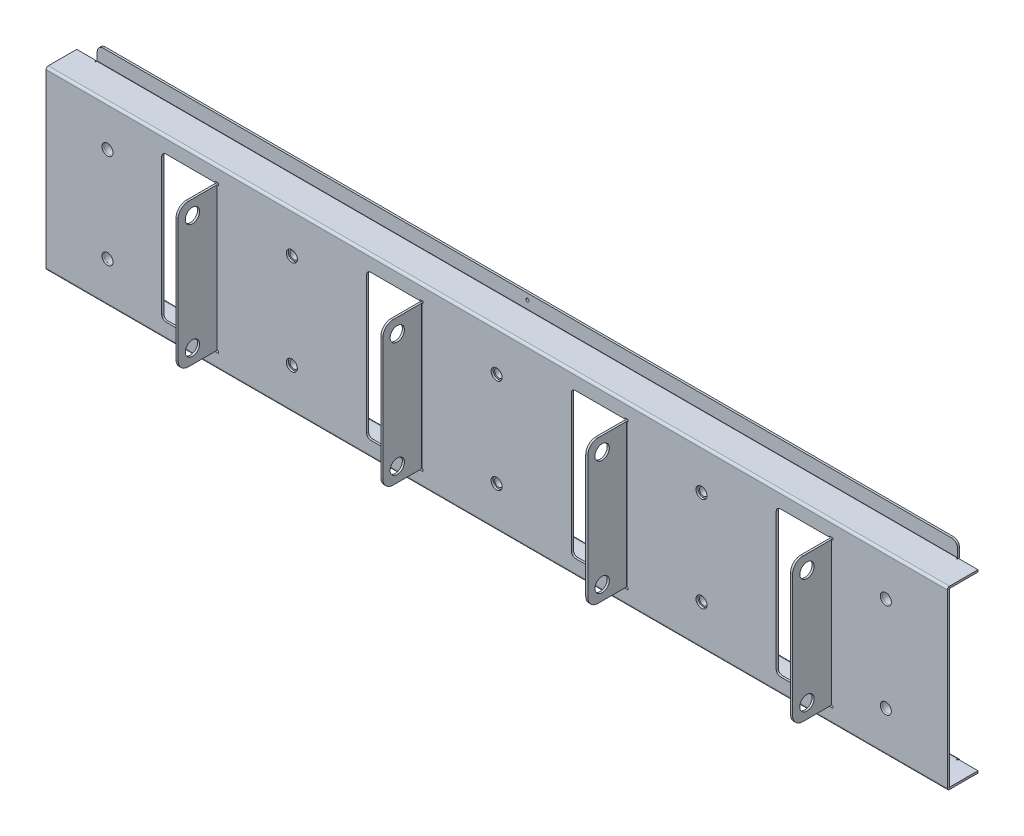
from build123d import *

# Parameters (mm, degrees)
SKETCH_1_W                          = 440
SKETCH_1_H                          = 86
SM_BASE_FLANGE_1_DEPTH              = 1
SM_EDGE_FLANGE_1_STRIP_W            = 4.2
SM_EDGE_FLANGE_1_STRIP_H            = 1
SM_EDGE_FLANGE_1_STRIP_CUT_DEPTH    = 440
SM_EDGE_FLANGE_1_STRIP_2_W          = 4.2
SM_EDGE_FLANGE_1_STRIP_2_H          = 1
SM_EDGE_FLANGE_1_STRIP_CUT_2_DEPTH  = 440
SM_EDGE_FLANGE_1_DEPTH              = 440
SM_EDGE_FLANGE_1_BEND_DEPTH         = 440
SM_EDGE_FLANGE_2_STRIP_W            = 5.2
SM_EDGE_FLANGE_2_STRIP_H            = 1
SM_EDGE_FLANGE_2_STRIP_CUT_DEPTH    = 420
SM_EDGE_FLANGE_2_RELIEF_W           = 5.7
SM_EDGE_FLANGE_2_RELIEF_H           = 0.5
SM_EDGE_FLANGE_2_RELIEF_CUT_DEPTH   = 1
SM_EDGE_FLANGE_2_STRIP_2_W          = 5.2
SM_EDGE_FLANGE_2_STRIP_2_H          = 1
SM_EDGE_FLANGE_2_STRIP_CUT_2_DEPTH  = 420
SM_EDGE_FLANGE_2_RELIEF_2_W         = 5.7
SM_EDGE_FLANGE_2_RELIEF_2_H         = 0.5
SM_EDGE_FLANGE_2_RELIEF_CUT_2_DEPTH = 1
SM_EDGE_FLANGE_2_DEPTH              = 420
SM_EDGE_FLANGE_2_BEND_DEPTH         = 420
SKETCH_18_W                         = 26
SKETCH_18_H                         = 71
CUT_EXTRUDE_1_DEPTH                 = 10
SM_START                            = -36
SM_EDGE_FLANGE_3_DEPTH              = 72
SM_EDGE_FLANGE_3_2_DEPTH            = 0.5
SM_START_2                          = 35.5
SM_EDGE_FLANGE_3_3_DEPTH            = 0.5
SM_START_3                          = -35.5
SM_EDGE_FLANGE_3_4_DEPTH            = 71
SKETCH_22_R                         = 3.5
CUT_EXTRUDE_2_DEPTH                 = 10
FILLET_1_R                          = 5
PATTERN_LINEAR_4_COUNT              = 2
PATTERN_LINEAR_4_PITCH              = 100
FILLET_1_OF_PATTERN_LINEAR_4_R      = 5
PATTERN_LINEAR_5_COUNT              = 3
PATTERN_LINEAR_5_PITCH              = 100
FILLET_1_OF_PATTERN_LINEAR_5_R      = 5
FILLET_2_R                          = 3
FILLET_3_R                          = 2
SKETCH_23_R                         = 2.7
CUT_EXTRUDE_3_DEPTH                 = 10
SKETCH_24_R                         = 4
SKETCH_24_R_2                       = 2
EXTRUDE_1_DEPTH                     = 3
EXTRUDE_1_2_DEPTH                   = 3
EXTRUDE_1_3_DEPTH                   = 3
EXTRUDE_1_4_DEPTH                   = 3
EXTRUDE_1_5_DEPTH                   = 3
EXTRUDE_1_6_DEPTH                   = 3
SKETCH_24_R_3                       = 2.7
EXTRUDE_1_7_DEPTH                   = 3
EXTRUDE_1_8_DEPTH                   = 3
EXTRUDE_1_9_DEPTH                   = 3
EXTRUDE_1_10_DEPTH                  = 3
CUT_EXTRUDE_5_DEPTH                 = 227.408922086
CUT_EXTRUDE_5_DEPTH_BACK            = 227.408922086
SKETCH_25_R                         = 0.75
MOVE_START                          = -137.5
MOVE_FACE_1_DEPTH                   = 301.1
MOVE_FACE_1_2_OUTLINE_W             = 0.5
MOVE_FACE_1_2_OUTLINE_H             = 1
MOVE_FACE_1_2_DEPTH                 = 1.6
MOVE_START_2                        = -37.5
MOVE_FACE_1_3_OUTLINE_W             = 0.5
MOVE_FACE_1_3_OUTLINE_H             = 1
MOVE_FACE_1_3_DEPTH                 = 1.6
MOVE_START_3                        = 62.5
MOVE_FACE_1_4_OUTLINE_W             = 0.5
MOVE_FACE_1_4_OUTLINE_H             = 1
MOVE_FACE_1_4_DEPTH                 = 1.6
MOVE_START_4                        = 162.5
MOVE_FACE_1_5_OUTLINE_W             = 0.5
MOVE_FACE_1_5_OUTLINE_H             = 1
MOVE_FACE_1_5_DEPTH                 = 1.6
MOVE_FACE_2_DEPTH                   = 301.1
MOVE_FACE_2_2_OUTLINE_W             = 0.5
MOVE_FACE_2_2_OUTLINE_H             = 1
MOVE_FACE_2_2_DEPTH                 = 1.6
MOVE_FACE_2_3_OUTLINE_W             = 0.5
MOVE_FACE_2_3_OUTLINE_H             = 1
MOVE_FACE_2_3_DEPTH                 = 1.6
MOVE_FACE_2_4_OUTLINE_W             = 0.5
MOVE_FACE_2_4_OUTLINE_H             = 1
MOVE_FACE_2_4_DEPTH                 = 1.6
MOVE_FACE_2_5_OUTLINE_W             = 0.5
MOVE_FACE_2_5_OUTLINE_H             = 1
MOVE_FACE_2_5_DEPTH                 = 1.6


# Read off the part's stored shape, not the designer's step: 边线-法兰3, 移动面1, 移动面2
# Sheet-metal steps are written as plain solids
with BuildPart() as part:
    # Sketch 1 → 基体-法兰1 (new body)
    with BuildSketch(Plane.XY):
        Rectangle(SKETCH_1_W, SKETCH_1_H)
    extrude(amount=-SM_BASE_FLANGE_1_DEPTH)

    # 边线-法兰1 strip (across the edge) → 边线-法兰1 strip cut (cut)
    with BuildSketch(Plane(origin=(-220, 43, -1), x_dir=(0, -1, 0), z_dir=(1, 0, 0))):
        with Locations((-1, -0.5)):
            Rectangle(SM_EDGE_FLANGE_1_STRIP_W, SM_EDGE_FLANGE_1_STRIP_H)
    extrude(amount=SM_EDGE_FLANGE_1_STRIP_CUT_DEPTH, mode=Mode.SUBTRACT)

    # 边线-法兰1 strip 2 (across the edge) → 边线-法兰1 strip cut 2 (cut)
    with BuildSketch(Plane(origin=(220, -43, -1), x_dir=(0, 1, 0), z_dir=(-1, 0, 0))):
        with Locations((-1, -0.5)):
            Rectangle(SM_EDGE_FLANGE_1_STRIP_2_W, SM_EDGE_FLANGE_1_STRIP_2_H)
    extrude(amount=SM_EDGE_FLANGE_1_STRIP_CUT_2_DEPTH, mode=Mode.SUBTRACT)

    # 边线-法兰1 section (across the edge) → 边线-法兰1 (add)
    with BuildSketch(Plane(origin=(-220, 43, -1), x_dir=(0, -1, 0), z_dir=(1, 0, 0))):
        with BuildLine():
            Line((0, 0.1), (0, 14))
            Line((0, 14), (1, 14))
            Line((1, 14), (1, 0.1))
            ThreePointArc((1, 0.1), (1.029289322, 0.029289322), (1.1, 0))
            Line((1.1, 0), (1.1, -1))
            ThreePointArc((1.1, -1), (0.322182541, -0.677817459), (0, 0.1))
        make_face()
    extrude(amount=SM_EDGE_FLANGE_1_DEPTH)

    # 边线-法兰1 section 2 (across the edge) → 边线-法兰1 bend (add)
    with BuildSketch(Plane(origin=(220, -43, -1), x_dir=(0, 1, 0), z_dir=(-1, 0, 0))):
        with BuildLine():
            Line((0, 0.1), (0, 14))
            Line((0, 14), (1, 14))
            Line((1, 14), (1, 0.1))
            ThreePointArc((1, 0.1), (1.029289322, 0.029289322), (1.1, 0))
            Line((1.1, 0), (1.1, -1))
            ThreePointArc((1.1, -1), (0.322182541, -0.677817459), (0, 0.1))
        make_face()
    extrude(amount=SM_EDGE_FLANGE_1_BEND_DEPTH)

    # 边线-法兰2 strip (across the edge) → 边线-法兰2 strip cut (cut)
    with BuildSketch(Plane(origin=(210, 43, -16), x_dir=(0, 0, 1), z_dir=(-1, 0, 0))):
        with Locations((-1.5, -0.5)):
            Rectangle(SM_EDGE_FLANGE_2_STRIP_W, SM_EDGE_FLANGE_2_STRIP_H)
    extrude(amount=SM_EDGE_FLANGE_2_STRIP_CUT_DEPTH, mode=Mode.SUBTRACT)

    # 边线-法兰2 relief (on the sheet) → 边线-法兰2 relief cut (cut)
    with BuildSketch(Plane(origin=(210, 43, -14.9), x_dir=(0, 0, 1), z_dir=(0, 1, 0))):
        with Locations((-2.35, 0.25)):
            Rectangle(SM_EDGE_FLANGE_2_RELIEF_W, SM_EDGE_FLANGE_2_RELIEF_H)
        with Locations((-2.35, -420.25)):
            Rectangle(SM_EDGE_FLANGE_2_RELIEF_W, SM_EDGE_FLANGE_2_RELIEF_H)
    extrude(amount=-SM_EDGE_FLANGE_2_RELIEF_CUT_DEPTH, mode=Mode.SUBTRACT)

    # 边线-法兰2 strip 2 (across the edge) → 边线-法兰2 strip cut 2 (cut)
    with BuildSketch(Plane(origin=(-210, -43, -16), x_dir=(0, 0, 1), z_dir=(1, 0, 0))):
        with Locations((-1.5, -0.5)):
            Rectangle(SM_EDGE_FLANGE_2_STRIP_2_W, SM_EDGE_FLANGE_2_STRIP_2_H)
    extrude(amount=SM_EDGE_FLANGE_2_STRIP_CUT_2_DEPTH, mode=Mode.SUBTRACT)

    # 边线-法兰2 relief 2 (on the sheet) → 边线-法兰2 relief cut 2 (cut)
    with BuildSketch(Plane(origin=(-210, -43, -14.9), x_dir=(0, 0, 1), z_dir=(0, -1, 0))):
        with Locations((-2.35, 0.25)):
            Rectangle(SM_EDGE_FLANGE_2_RELIEF_2_W, SM_EDGE_FLANGE_2_RELIEF_2_H)
        with Locations((-2.35, -420.25)):
            Rectangle(SM_EDGE_FLANGE_2_RELIEF_2_W, SM_EDGE_FLANGE_2_RELIEF_2_H)
    extrude(amount=-SM_EDGE_FLANGE_2_RELIEF_CUT_2_DEPTH, mode=Mode.SUBTRACT)

    # 边线-法兰2 section (across the edge) → 边线-法兰2 (add)
    with BuildSketch(Plane(origin=(210, 43, -16), x_dir=(0, 0, 1), z_dir=(-1, 0, 0))):
        with BuildLine():
            Line((0, 0.1), (0, 7))
            Line((0, 7), (1, 7))
            Line((1, 7), (1, 0.1))
            ThreePointArc((1, 0.1), (1.029289322, 0.029289322), (1.1, 0))
            Line((1.1, 0), (1.1, -1))
            ThreePointArc((1.1, -1), (0.322182541, -0.677817459), (0, 0.1))
        make_face()
    extrude(amount=SM_EDGE_FLANGE_2_DEPTH)

    # 边线-法兰2 section 2 (across the edge) → 边线-法兰2 bend (add)
    with BuildSketch(Plane(origin=(-210, -43, -16), x_dir=(0, 0, 1), z_dir=(1, 0, 0))):
        with BuildLine():
            Line((0, 0.1), (0, 7))
            Line((0, 7), (1, 7))
            Line((1, 7), (1, 0.1))
            ThreePointArc((1, 0.1), (1.029289322, 0.029289322), (1.1, 0))
            Line((1.1, 0), (1.1, -1))
            ThreePointArc((1.1, -1), (0.322182541, -0.677817459), (0, 0.1))
        make_face()
    extrude(amount=SM_EDGE_FLANGE_2_BEND_DEPTH)

    # 草图18 → 切除-拉伸1 (cut)
    with BuildSketch(Plane.XY):
        with Locations((49.5, 0)):
            Rectangle(SKETCH_18_W, SKETCH_18_H)
    cut_extrude_1 = extrude(amount=-CUT_EXTRUDE_1_DEPTH, mode=Mode.SUBTRACT)

    # 边线-法兰3 outline → 边线-法兰3 (cut)
    with BuildSketch(Plane(origin=(0, 0, 0), x_dir=(1, 0, 0), z_dir=(0, 1, 0)).offset(SM_START)):
        with BuildLine():
            ThreePointArc((62.504554885, 0), (62.858380152, 0.71240384), (63.6, 1))
            Line((63.6, 1), (62.5, 1))
            Line((62.5, 1), (62.5, 0))
            Line((62.5, 0), (62.504554885, 0))
        make_face()
    sm_edge_flange_3 = extrude(amount=SM_EDGE_FLANGE_3_DEPTH, mode=Mode.SUBTRACT)

    # Sm Edge Flange 3 2 outline → Sm Edge Flange 3 2 (cut)
    with BuildSketch(Plane(origin=(0, 0, 0), x_dir=(1, 0, 0), z_dir=(0, 1, 0)).offset(SM_START)):
        with BuildLine():
            Line((64.1, 0), (64.1, 1))
            Line((64.1, 1), (63.6, 1))
            ThreePointArc((63.6, 1), (62.858380152, 0.71240384), (62.504554885, 0))
            Line((62.504554885, 0), (64.1, 0))
        make_face()
    sm_edge_flange_3_2 = extrude(amount=SM_EDGE_FLANGE_3_2_DEPTH, mode=Mode.SUBTRACT)

    # Sm Edge Flange 3 3 outline → Sm Edge Flange 3 3 (cut)
    with BuildSketch(Plane(origin=(0, 0, 0), x_dir=(1, 0, 0), z_dir=(0, 1, 0)).offset(SM_START_2)):
        with BuildLine():
            Line((64.1, 0), (64.1, 1))
            Line((64.1, 1), (63.6, 1))
            ThreePointArc((63.6, 1), (62.858380152, 0.71240384), (62.504554885, 0))
            Line((62.504554885, 0), (64.1, 0))
        make_face()
    sm_edge_flange_3_3 = extrude(amount=SM_EDGE_FLANGE_3_3_DEPTH, mode=Mode.SUBTRACT)

    # Sm Edge Flange 3 4 outline → Sm Edge Flange 3 4 (add)
    with BuildSketch(Plane(origin=(0, 0, 0), x_dir=(1, 0, 0), z_dir=(0, 1, 0)).offset(SM_START_3)):
        with BuildLine():
            ThreePointArc((63.5, -0.1), (63.529289322, -0.029289322), (63.6, 0))
            Line((63.6, 0), (62.504554885, 0))
            ThreePointArc((62.504554885, 0), (62.501139311, -0.049948159), (62.5, -0.1))
            Line((62.5, -0.1), (62.5, -19))
            Line((62.5, -19), (63.5, -19))
            Line((63.5, -19), (63.5, -0.1))
        make_face()
    sm_edge_flange_3_4 = extrude(amount=SM_EDGE_FLANGE_3_4_DEPTH)

    # 草图22 → 切除-拉伸2 (cut)
    with BuildSketch(Plane.ZY.offset(-62.5)):
        with Locations((12, 28)):
            Circle(SKETCH_22_R)
        with Locations((12, -28)):
            Circle(SKETCH_22_R)
    cut_extrude_2 = extrude(amount=-CUT_EXTRUDE_2_DEPTH, mode=Mode.SUBTRACT)

    # 圆角1
    fillet_1_edges = [part.edges().sort_by_distance(p)[0] for p in [
        (63, 35.5, 19),
        (63, -35.5, 19),
    ]]
    fillet(fillet_1_edges, radius=FILLET_1_R)

    # 阵列(线性)4: 切除-拉伸1, 边线-法兰3, Sm Edge Flange 3 2, Sm Edge Flange 3 3, Sm Edge Flange 3 4, 切除-拉伸2 ×2
    with Locations(*[(i * PATTERN_LINEAR_4_PITCH, 0, 0) for i in range(1, PATTERN_LINEAR_4_COUNT)]):
        add(cut_extrude_1, mode=Mode.SUBTRACT)
        add(sm_edge_flange_3, mode=Mode.SUBTRACT)
        add(sm_edge_flange_3_2, mode=Mode.SUBTRACT)
        add(sm_edge_flange_3_3, mode=Mode.SUBTRACT)
        add(sm_edge_flange_3_4)
        add(cut_extrude_2, mode=Mode.SUBTRACT)

    # 圆角1 of 阵列(线性)4
    fillet_1_of_pattern_linear_4_edges = [part.edges().sort_by_distance(p)[0] for p in [
        (163, 35.5, 19),
        (163, -35.5, 19),
    ]]
    fillet(fillet_1_of_pattern_linear_4_edges, radius=FILLET_1_OF_PATTERN_LINEAR_4_R)

    # 阵列(线性)5: 切除-拉伸1, 边线-法兰3, Sm Edge Flange 3 2, Sm Edge Flange 3 3, Sm Edge Flange 3 4, 切除-拉伸2 ×3
    with Locations(*[(-i * PATTERN_LINEAR_5_PITCH, 0, 0) for i in range(1, PATTERN_LINEAR_5_COUNT)]):
        add(cut_extrude_1, mode=Mode.SUBTRACT)
        add(sm_edge_flange_3, mode=Mode.SUBTRACT)
        add(sm_edge_flange_3_2, mode=Mode.SUBTRACT)
        add(sm_edge_flange_3_3, mode=Mode.SUBTRACT)
        add(sm_edge_flange_3_4)
        add(cut_extrude_2, mode=Mode.SUBTRACT)

    # 圆角1 of 阵列(线性)5
    fillet_1_of_pattern_linear_5_edges = [part.edges().sort_by_distance(p)[0] for p in [
        (-37, 35.5, 19),
        (-37, -35.5, 19),
        (-137, 35.5, 19),
        (-137, -35.5, 19),
    ]]
    fillet(fillet_1_of_pattern_linear_5_edges, radius=FILLET_1_OF_PATTERN_LINEAR_5_R)

    # 圆角2
    fillet_2_edges = [part.edges().sort_by_distance(p)[0] for p in [
        (210, 50, -15.5),
        (-210, 50, -15.5),
        (-210, -50, -15.5),
        (210, -50, -15.5),
    ]]
    fillet(fillet_2_edges, radius=FILLET_2_R)

    # 圆角3
    fillet_3_edges = [part.edges().sort_by_distance(p)[0] for p in [
        (36.5, -35.5, -0.5),
        (36.5, 35.5, -0.5),
        (136.5, -35.5, -0.5),
        (136.5, 35.5, -0.5),
        (-63.5, -35.5, -0.5),
        (-63.5, 35.5, -0.5),
        (-163.5, -35.5, -0.5),
        (-163.5, 35.5, -0.5),
    ]]
    fillet(fillet_3_edges, radius=FILLET_3_R)

    # 草图23 → 切除-拉伸3 (cut)
    with BuildSketch(Plane.XY):
        with Locations((100, 23.1)):
            Circle(SKETCH_23_R)
        with Locations((100, -23.1)):
            Circle(SKETCH_23_R)
        with Locations((0, 23.1)):
            Circle(SKETCH_23_R)
        with Locations((0, -23.1)):
            Circle(SKETCH_23_R)
        with Locations((-100, 23.1)):
            Circle(SKETCH_23_R)
        with Locations((-100, -23.1)):
            Circle(SKETCH_23_R)
        with Locations((190, 23.1)):
            Circle(SKETCH_23_R)
        with Locations((190, -23.1)):
            Circle(SKETCH_23_R)
        with Locations((-190, -23.1)):
            Circle(SKETCH_23_R)
        with Locations((-190, 23.1)):
            Circle(SKETCH_23_R)
    extrude(amount=-CUT_EXTRUDE_3_DEPTH, mode=Mode.SUBTRACT)

    # 草图25 → 切除-拉伸5 (cut, two sides: drawn at the far end of the back side and taken through both)
    with BuildSketch(Plane.XY.offset(-CUT_EXTRUDE_5_DEPTH_BACK)):
        with Locations((0, 47)):
            Circle(SKETCH_25_R)
        with Locations(Location((-50, -47, 0), (0, 0, 180))):
            Circle(SKETCH_25_R)
        with Locations(Location((50, -47, 0), (0, 0, 180))):
            Circle(SKETCH_25_R)
    extrude(amount=CUT_EXTRUDE_5_DEPTH + CUT_EXTRUDE_5_DEPTH_BACK, mode=Mode.SUBTRACT)

    # Move Face 1 outline → Move Face 1 (cut)
    with BuildSketch(Plane.YZ.offset(MOVE_START)):
        with BuildLine():
            Line((35, 14), (35, 0))
            Line((35, 0), (35.5, 0))
            Line((35.5, 0), (35.5, 14))
            ThreePointArc((35.5, 14), (34.035533906, 17.535533906), (30.5, 19))
            Line((30.5, 19), (30, 19))
            ThreePointArc((30, 19), (33.535533906, 17.535533906), (35, 14))
        make_face()
    extrude(amount=MOVE_FACE_1_DEPTH, mode=Mode.SUBTRACT)

    # Move Face 1 2 outline → Move Face 1 2 (cut)
    with BuildSketch(Plane.YZ.offset(MOVE_START)):
        with Locations((35.25, -0.5)):
            Rectangle(MOVE_FACE_1_2_OUTLINE_W, MOVE_FACE_1_2_OUTLINE_H)
    extrude(amount=MOVE_FACE_1_2_DEPTH, mode=Mode.SUBTRACT)

    # Move Face 1 3 outline → Move Face 1 3 (cut)
    with BuildSketch(Plane.YZ.offset(MOVE_START_2)):
        with Locations((35.25, -0.5)):
            Rectangle(MOVE_FACE_1_3_OUTLINE_W, MOVE_FACE_1_3_OUTLINE_H)
    extrude(amount=MOVE_FACE_1_3_DEPTH, mode=Mode.SUBTRACT)

    # Move Face 1 4 outline → Move Face 1 4 (cut)
    with BuildSketch(Plane.YZ.offset(MOVE_START_3)):
        with Locations((35.25, -0.5)):
            Rectangle(MOVE_FACE_1_4_OUTLINE_W, MOVE_FACE_1_4_OUTLINE_H)
    extrude(amount=MOVE_FACE_1_4_DEPTH, mode=Mode.SUBTRACT)

    # Move Face 1 5 outline → Move Face 1 5 (cut)
    with BuildSketch(Plane.YZ.offset(MOVE_START_4)):
        with Locations((35.25, -0.5)):
            Rectangle(MOVE_FACE_1_5_OUTLINE_W, MOVE_FACE_1_5_OUTLINE_H)
    extrude(amount=MOVE_FACE_1_5_DEPTH, mode=Mode.SUBTRACT)

    # Move Face 2 outline → Move Face 2 (cut)
    with BuildSketch(Plane.YZ.offset(MOVE_START)):
        with BuildLine():
            Line((-35.5, 0), (-35, 0))
            Line((-35, 0), (-35, 14))
            ThreePointArc((-35, 14), (-33.535533906, 17.535533906), (-30, 19))
            Line((-30, 19), (-30.5, 19))
            ThreePointArc((-30.5, 19), (-34.035533906, 17.535533906), (-35.5, 14))
            Line((-35.5, 14), (-35.5, 0))
        make_face()
    extrude(amount=MOVE_FACE_2_DEPTH, mode=Mode.SUBTRACT)

    # Move Face 2 2 outline → Move Face 2 2 (cut)
    with BuildSketch(Plane.YZ.offset(MOVE_START)):
        with Locations((-35.25, -0.5)):
            Rectangle(MOVE_FACE_2_2_OUTLINE_W, MOVE_FACE_2_2_OUTLINE_H)
    extrude(amount=MOVE_FACE_2_2_DEPTH, mode=Mode.SUBTRACT)

    # Move Face 2 3 outline → Move Face 2 3 (cut)
    with BuildSketch(Plane.YZ.offset(MOVE_START_2)):
        with Locations((-35.25, -0.5)):
            Rectangle(MOVE_FACE_2_3_OUTLINE_W, MOVE_FACE_2_3_OUTLINE_H)
    extrude(amount=MOVE_FACE_2_3_DEPTH, mode=Mode.SUBTRACT)

    # Move Face 2 4 outline → Move Face 2 4 (cut)
    with BuildSketch(Plane.YZ.offset(MOVE_START_3)):
        with Locations((-35.25, -0.5)):
            Rectangle(MOVE_FACE_2_4_OUTLINE_W, MOVE_FACE_2_4_OUTLINE_H)
    extrude(amount=MOVE_FACE_2_4_DEPTH, mode=Mode.SUBTRACT)

    # Move Face 2 5 outline → Move Face 2 5 (cut)
    with BuildSketch(Plane.YZ.offset(MOVE_START_4)):
        with Locations((-35.25, -0.5)):
            Rectangle(MOVE_FACE_2_5_OUTLINE_W, MOVE_FACE_2_5_OUTLINE_H)
    extrude(amount=MOVE_FACE_2_5_DEPTH, mode=Mode.SUBTRACT)


with BuildPart() as body_2:
    # 草图24 → 凸台-拉伸1 (new body)
    with BuildSketch(Plane(origin=(0, 0, -1), x_dir=(-1, 0, 0), z_dir=(0, 0, -1))):
        with Locations((-100, 23.1)):
            Circle(SKETCH_24_R)
        with Locations((-100, 23.1)):
            Circle(SKETCH_24_R_2, mode=Mode.SUBTRACT)
    extrude(amount=EXTRUDE_1_DEPTH)


with BuildPart() as body_3:
    # 草图24 → Extrude 1 2 (new body)
    with BuildSketch(Plane(origin=(0, 0, -1), x_dir=(-1, 0, 0), z_dir=(0, 0, -1))):
        with Locations(Location((-100, -23.1, 0), (0, 0, 180))):
            Circle(SKETCH_24_R)
        with Locations(Location((-100, -23.1, 0), (0, 0, 180))):
            Circle(SKETCH_24_R_2, mode=Mode.SUBTRACT)
    extrude(amount=EXTRUDE_1_2_DEPTH)


with BuildPart() as body_4:
    # 草图24 → Extrude 1 3 (new body)
    with BuildSketch(Plane(origin=(0, 0, -1), x_dir=(-1, 0, 0), z_dir=(0, 0, -1))):
        with Locations((0, 23.1)):
            Circle(SKETCH_24_R)
        with Locations((0, 23.1)):
            Circle(SKETCH_24_R_2, mode=Mode.SUBTRACT)
    extrude(amount=EXTRUDE_1_3_DEPTH)


with BuildPart() as body_5:
    # 草图24 → Extrude 1 4 (new body)
    with BuildSketch(Plane(origin=(0, 0, -1), x_dir=(-1, 0, 0), z_dir=(0, 0, -1))):
        with Locations(Location((0, -23.1, 0), (0, 0, 180))):
            Circle(SKETCH_24_R)
        with Locations(Location((0, -23.1, 0), (0, 0, 180))):
            Circle(SKETCH_24_R_2, mode=Mode.SUBTRACT)
    extrude(amount=EXTRUDE_1_4_DEPTH)


with BuildPart() as body_6:
    # 草图24 → Extrude 1 5 (new body)
    with BuildSketch(Plane(origin=(0, 0, -1), x_dir=(-1, 0, 0), z_dir=(0, 0, -1))):
        with Locations((100, 23.1)):
            Circle(SKETCH_24_R)
        with Locations((100, 23.1)):
            Circle(SKETCH_24_R_2, mode=Mode.SUBTRACT)
    extrude(amount=EXTRUDE_1_5_DEPTH)


with BuildPart() as body_7:
    # 草图24 → Extrude 1 6 (new body)
    with BuildSketch(Plane(origin=(0, 0, -1), x_dir=(-1, 0, 0), z_dir=(0, 0, -1))):
        with Locations(Location((100, -23.1, 0), (0, 0, 180))):
            Circle(SKETCH_24_R)
        with Locations(Location((100, -23.1, 0), (0, 0, 180))):
            Circle(SKETCH_24_R_2, mode=Mode.SUBTRACT)
    extrude(amount=EXTRUDE_1_6_DEPTH)


with BuildPart() as body_8:
    # 草图24 → Extrude 1 7 (new body)
    with BuildSketch(Plane(origin=(0, 0, -1), x_dir=(-1, 0, 0), z_dir=(0, 0, -1))):
        with Locations((-190, 23.1)):
            Circle(SKETCH_24_R)
        with Locations((-190, 23.1)):
            Circle(SKETCH_24_R_3, mode=Mode.SUBTRACT)
    extrude(amount=EXTRUDE_1_7_DEPTH)


with BuildPart() as body_9:
    # 草图24 → Extrude 1 8 (new body)
    with BuildSketch(Plane(origin=(0, 0, -1), x_dir=(-1, 0, 0), z_dir=(0, 0, -1))):
        with Locations(Location((-190, -23.1, 0), (0, 0, 180))):
            Circle(SKETCH_24_R)
        with Locations(Location((-190, -23.1, 0), (0, 0, 180))):
            Circle(SKETCH_24_R_3, mode=Mode.SUBTRACT)
    extrude(amount=EXTRUDE_1_8_DEPTH)


with BuildPart() as body_10:
    # 草图24 → Extrude 1 9 (new body)
    with BuildSketch(Plane(origin=(0, 0, -1), x_dir=(-1, 0, 0), z_dir=(0, 0, -1))):
        with Locations((190, -23.1)):
            Circle(SKETCH_24_R)
        with Locations((190, -23.1)):
            Circle(SKETCH_24_R_3, mode=Mode.SUBTRACT)
    extrude(amount=EXTRUDE_1_9_DEPTH)


with BuildPart() as body_11:
    # 草图24 → Extrude 1 10 (new body)
    with BuildSketch(Plane(origin=(0, 0, -1), x_dir=(-1, 0, 0), z_dir=(0, 0, -1))):
        with Locations(Location((190, 23.1, 0), (0, 0, 180))):
            Circle(SKETCH_24_R)
        with Locations(Location((190, 23.1, 0), (0, 0, 180))):
            Circle(SKETCH_24_R_3, mode=Mode.SUBTRACT)
    extrude(amount=EXTRUDE_1_10_DEPTH)


solid = Compound([part.part, body_2.part, body_3.part, body_4.part, body_5.part, body_6.part, body_7.part, body_8.part, body_9.part, body_10.part, body_11.part])
